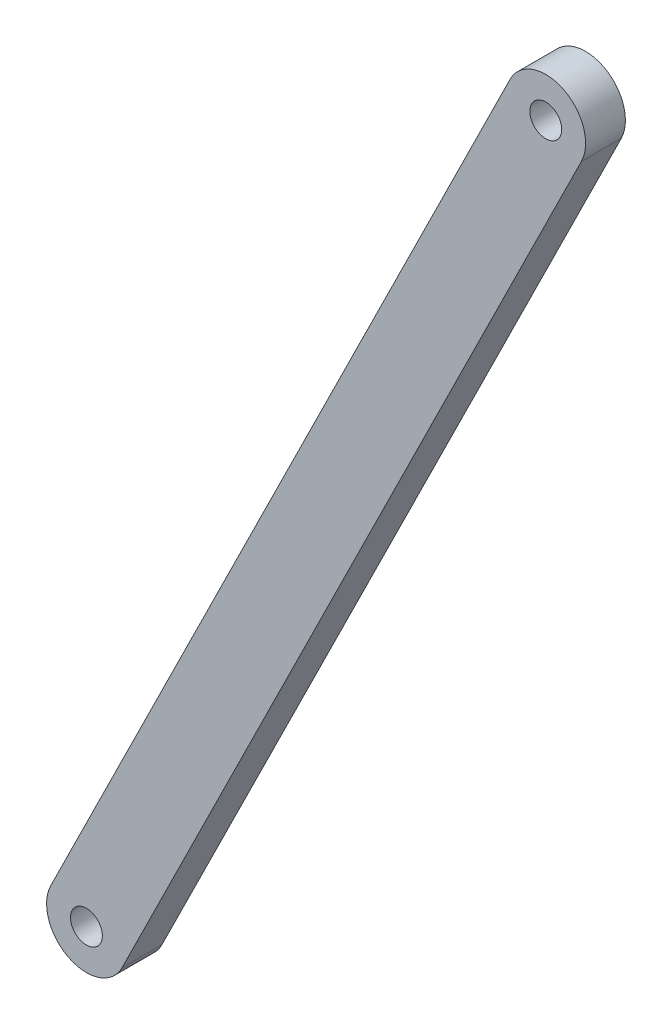
from build123d import *

# Parameters (mm, degrees)
BOSS_EXTRUDE1_START = 5
SKETCH1_R           = 2
BOSS_EXTRUDE1_DEPTH = 5


with BuildPart() as part:
    # Sketch1 → Boss-Extrude1 (new body)
    with BuildSketch(Plane.XY.offset(BOSS_EXTRUDE1_START)):
        with BuildLine():
            Line((42.108032522, 122.38823698), (-15.564142207, 5.881068694))
            ThreePointArc((-15.564142207, 5.881068694), (-22.263347708, 3.618184326), (-24.526232075, 10.317389827))
            Line((-24.526232075, 10.317389827), (33.145942654, 126.824558113))
            ThreePointArc((33.145942654, 126.824558113), (39.845148154, 129.087442481), (42.108032522, 122.38823698))
        make_face()
        with Locations((-20.045187141, 8.09922926)):
            Circle(SKETCH1_R, mode=Mode.SUBTRACT)
        with Locations((37.626987588, 124.606397547)):
            Circle(SKETCH1_R, mode=Mode.SUBTRACT)
    extrude(amount=BOSS_EXTRUDE1_DEPTH)


solid = part.part
